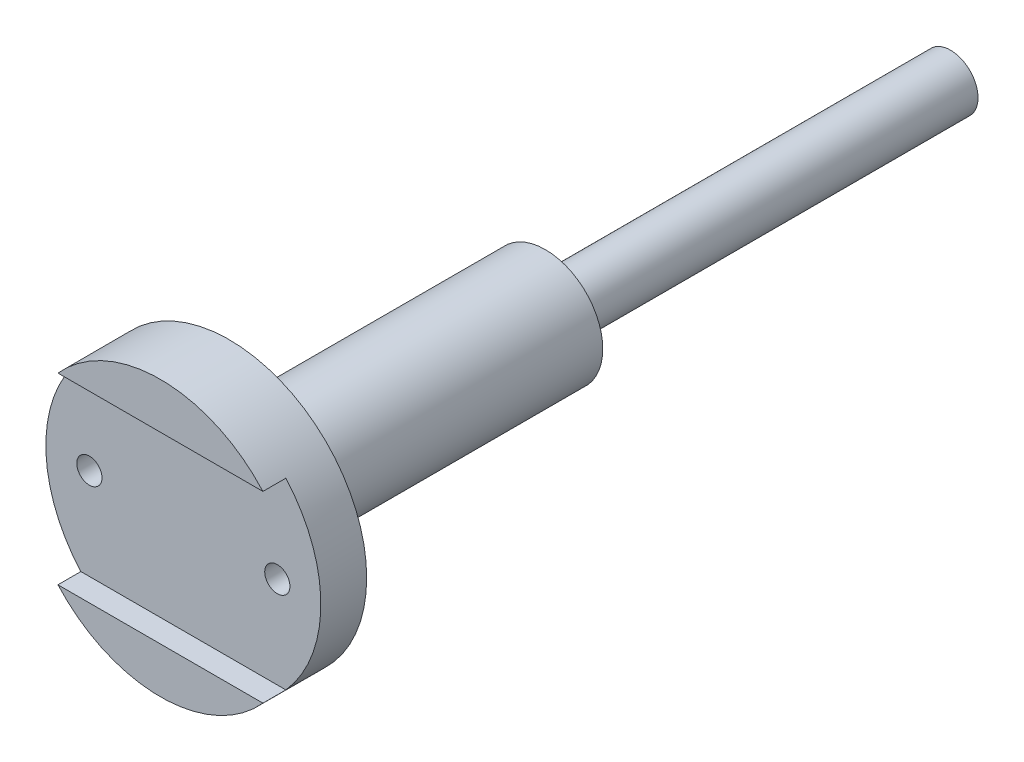
from build123d import *

# Parameters (mm, degrees)
ESQUISSE1_R                                = 30
BOSS_EXTRU_1_DEPTH                         = 15
ESQUISSE2_R                                = 12.5
BOSS_EXTRU_2_DEPTH                         = 69
ESQUISSE4_2_W                              = 230
ESQUISSE4_2_H                              = 40
ENL_V_MAT_EXTRU_1_DEPTH                    = 5
CHAMBRAGE_POUR_VIS_T_TE_HEXAGONALE_2_COUNT = 2
CHAMBRAGE_POUR_VIS_T_TE_HEXAGONALE_2_PITCH = 41
ESQUISSE17_R                               = 6
BOSS_EXTRU_4_DEPTH                         = 88.38
ESQUISSE18_W                               = 10.356322474
ESQUISSE18_H                               = 3
ENL_V_MAT_EXTRU_2_DEPTH                    = 3


with BuildPart() as part:
    # Esquisse1 → Boss.-Extru.1 (new body)
    with BuildSketch(Plane.XY):
        Circle(ESQUISSE1_R)
    extrude(amount=BOSS_EXTRU_1_DEPTH)

    # Esquisse2 → Boss.-Extru.2 (add)
    with BuildSketch(Plane(origin=(0, 0, 0), x_dir=(-1, 0, 0), z_dir=(0, 0, -1))):
        Circle(ESQUISSE2_R)
    extrude(amount=BOSS_EXTRU_2_DEPTH)

    # Esquisse4<2> → Enlèv. mat.-Extru.1 (cut)
    with BuildSketch(Plane.XY.offset(15)):
        Rectangle(ESQUISSE4_2_W, ESQUISSE4_2_H)
    extrude(amount=-ENL_V_MAT_EXTRU_1_DEPTH, mode=Mode.SUBTRACT)

    # Esquisse14 → Chambrage pour vis à tête hexagonale M51 (revolve, cut)
    with BuildSketch(Plane.YZ.offset(-20.5)):
        Polygon((0, 0), (0, 15), (2.75, 15), (2.75, 3.605), (2.775, 3.58), (6.12, 3.58), (6.12, 0), align=None)
    chambrage_pour_vis_t_te_hexagonale_m51 = revolve(axis=Axis((-20.5, 0, -6.35), (0, 0, 1)), mode=Mode.SUBTRACT)

    # Chambrage pour vis _ t_te hexagonale 2: Chambrage pour vis à tête hexagonale M51 ×2
    with Locations(*[(i * CHAMBRAGE_POUR_VIS_T_TE_HEXAGONALE_2_PITCH, 0, 0) for i in range(1, CHAMBRAGE_POUR_VIS_T_TE_HEXAGONALE_2_COUNT)]):
        add(chambrage_pour_vis_t_te_hexagonale_m51, mode=Mode.SUBTRACT)

    # Esquisse17 → Boss.-Extru.4 (add)
    with BuildSketch(Plane(origin=(0, 0, -69), x_dir=(-1, 0, 0), z_dir=(0, 0, -1))):
        Circle(ESQUISSE17_R)
    extrude(amount=BOSS_EXTRU_4_DEPTH)

    # Esquisse18 → Enlèv. mat.-Extru.2 (cut)
    with BuildSketch(Plane(origin=(0, 0, -157.38), x_dir=(-1, 0, 0), z_dir=(0, 0, -1))):
        with Locations((1.787207702, 0)):
            Rectangle(ESQUISSE18_W, ESQUISSE18_H)
    extrude(amount=-ENL_V_MAT_EXTRU_2_DEPTH, mode=Mode.SUBTRACT)


solid = part.part
